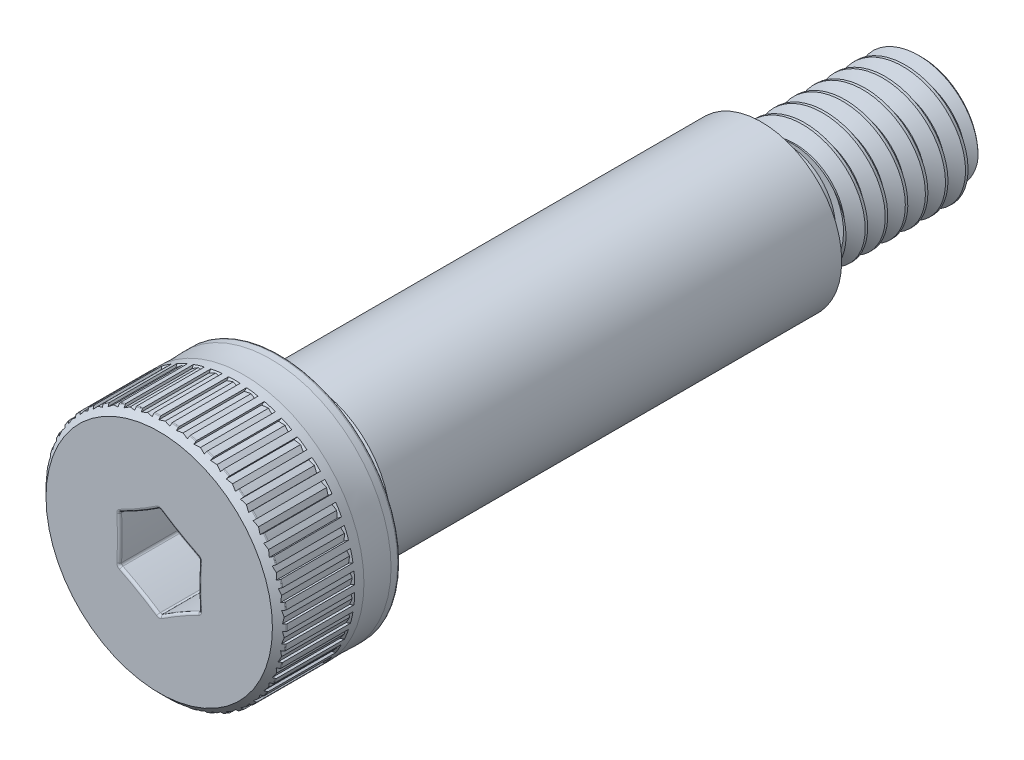
from build123d import *

# Parameters (mm, degrees)
SKETCH4_W             = 1.190625
SKETCH4_H             = 0.3175
SKETCH4_W_2           = 1.031875
SKETCH4_H_2           = 0.515555748
CHAMFER1_SIZE         = 0.3175
FILLET1_R             = 0.1905
FILLET2_R             = 0.15875
CHAMFER2_SIZE         = 0.1984375
CHAMFER3_SIZE         = 0.28575
CUT_EXTRUDE1_DEPTH    = 2.413
FILLET4_R             = 0.09525
DELETEFACE1_START     = -20.081875
DELETEFACE1_OUTLINE_W = 8
DELETEFACE1_OUTLINE_H = 8
DELETEFACE1_OUTLINE_R = 1.897444252
DELETEFACE1_DEPTH     = 0.1587501
CUT_SWEEP1_PITCH      = 0.79375
CUT_EXTRUDE2_REACH    = 32.905
CIRPATTERN1_COUNT     = 42
FILLET5_R             = 0.0508


# Read off the part's stored shape, not the designer's step: DeleteFace1, CirPattern2
with BuildPart() as part:
    # Sketch3 → Revolve1 (revolve)
    with BuildSketch(Plane(origin=(0, 0, 0), x_dir=(0, 0, -1), z_dir=(1, 0, 0)), mode=Mode.PRIVATE) as revolve1_sk:
        Polygon((-4.7625, 4.7625), (0, 4.7625), (0, 3.175), (19.05, 3.175), (19.05, 2.413), (25.4, 2.413), (25.4, 0), (-4.7625, 0), align=None)
    revolve(revolve1_sk.sketch.rotate(Axis((0, 0, 4.7625), (0, 0, -1)), 90), axis=Axis((0, 0, 4.7625), (0, 0, -1)))

    # Sketch4 → Cut-Revolve1 (revolve, cut)
    with BuildSketch(Plane(origin=(0, 0, 0), x_dir=(0, 0, -1), z_dir=(1, 0, 0)), mode=Mode.PRIVATE) as cut_revolve1_sk:
        with Locations((0.5953125, 3.01625)):
            Rectangle(SKETCH4_W, SKETCH4_H)
        with Locations((19.5659375, 2.155222126)):
            Rectangle(SKETCH4_W_2, SKETCH4_H_2)
    revolve(cut_revolve1_sk.sketch.rotate(Axis((0, 0, 4.7625), (0, 0, -1)), 90), axis=Axis((0, 0, 4.7625), (0, 0, -1)), mode=Mode.SUBTRACT)

    # Chamfer1
    chamfer1_edges = [part.edges().sort_by_distance(p)[0] for p in [
        (-2.8575, 0, -1.190625),
    ]]
    chamfer(chamfer1_edges, length=CHAMFER1_SIZE - 0.0001)  # a hair under: the kernel refuses the full size

    # Fillet1
    fillet1_edges = [part.edges().sort_by_distance(p)[0] for p in [
        (-2.8575, 0, 0),
    ]]
    fillet(fillet1_edges, radius=FILLET1_R)

    # Fillet2
    fillet2_edges = [part.edges().sort_by_distance(p)[0] for p in [
        (-1.897444252, 0, -19.05),
        (-1.897444252, 0, -20.081875),
    ]]
    fillet(fillet2_edges, radius=FILLET2_R)

    # Chamfer2
    chamfer2_edges = [part.edges().sort_by_distance(p)[0] for p in [
        (-2.413, 0, -20.081875),
        (-2.413, 0, -25.4),
    ]]
    chamfer(chamfer2_edges, length=CHAMFER2_SIZE)

    # Chamfer3
    chamfer3_edges = [part.edges().sort_by_distance(p)[0] for p in [
        (-4.7625, 0, 4.7625),
    ]]
    chamfer(chamfer3_edges, length=CHAMFER3_SIZE)

    # Sketch5 → Cut-Extrude1 (cut)
    with BuildSketch(Plane.XY.offset(4.7625)):
        with BuildLine():
            ThreePointArc((1.5875, 0.916543552), (0.777875, 1.347319022), (0, 1.833087105))
            ThreePointArc((0, 1.833087105), (-0.777875, 1.347319022), (-1.5875, 0.916543552))
            ThreePointArc((-1.5875, 0.916543552), (-1.55575, 0), (-1.5875, -0.916543552))
            ThreePointArc((-1.5875, -0.916543552), (-0.777875, -1.347319022), (0, -1.833087105))
            ThreePointArc((0, -1.833087105), (0.777875, -1.347319022), (1.5875, -0.916543552))
            ThreePointArc((1.5875, -0.916543552), (1.55575, 0), (1.5875, 0.916543552))
        make_face()
    extrude(amount=-CUT_EXTRUDE1_DEPTH, mode=Mode.SUBTRACT)

    # Fillet4
    fillet4_edges = [part.edges().sort_by_distance(p)[0] for p in [
        (1.55575, 0, 2.3495),
        (1.5875, 0.916543552, 3.556),
        (0.777875, -1.347319022, 2.3495),
        (1.5875, -0.916543552, 3.556),
        (-0.777875, -1.347319022, 2.3495),
        (0, -1.833087105, 3.556),
        (-1.55575, 0, 2.3495),
        (-1.5875, -0.916543552, 3.556),
        (-0.777875, 1.347319022, 2.3495),
        (-1.5875, 0.916543552, 3.556),
        (0.777875, 1.347319022, 2.3495),
        (0, 1.833087105, 3.556),
        (1.55575, 0, 4.7625),
        (0.777875, 1.347319022, 4.7625),
        (-0.777875, 1.347319022, 4.7625),
        (-1.55575, 0, 4.7625),
        (-0.777875, -1.347319022, 4.7625),
        (0.777875, -1.347319022, 4.7625),
        (-4.7625, 0, 0),
    ]]
    fillet(fillet4_edges, radius=FILLET4_R)

    # DeleteFace1 outline → DeleteFace1 (cut)
    with BuildSketch(Plane.XY.offset(DELETEFACE1_START)):
        Rectangle(DELETEFACE1_OUTLINE_W, DELETEFACE1_OUTLINE_H)
        Circle(DELETEFACE1_OUTLINE_R, mode=Mode.SUBTRACT)
    extrude(amount=DELETEFACE1_DEPTH, mode=Mode.SUBTRACT)

    # Cut-Sweep1: the profile of Sketch7 profile screwed along a right-hand helix of 7.48 turns, 8 arcs to a turn; built about Z, then put on its axis
    cut_sweep1_z = Axis((0, 0, 0), (0, 0, 1))
    cut_sweep1_corners = [(2.455962979, 0, 0.024804687), (2.455962979, 0, -0.719335937), (1.897144252, 0, -0.396701795), (1.897144252, 0, -0.297829455)]
    with BuildLine(mode=Mode.PRIVATE) as cut_sweep1_profile:
        Line(cut_sweep1_corners[0], cut_sweep1_corners[1])
        Line(cut_sweep1_corners[1], cut_sweep1_corners[2])
        Line(cut_sweep1_corners[2], cut_sweep1_corners[3])
        Line(cut_sweep1_corners[3], cut_sweep1_corners[0])
    cut_sweep1_cap = Face(cut_sweep1_profile.wire())
    cut_sweep1_turn_angles = [0, 22.5, 45, 67.5, 90, 112.5, 135, 157.5, 180, 202.5, 225, 247.5, 270, 292.5, 315, 337.5, 360]
    cut_sweep1_turn_weights = [1, 0.9238795325112867, 1, 0.9238795325112867, 1, 0.9238795325112867, 1, 0.9238795325112867, 1, 0.9238795325112867, 1, 0.9238795325112867, 1, 0.9238795325112867, 1, 0.9238795325112867, 1]
    cut_sweep1_turn_rails = [Edge.make_bspline([Vector(p[0], p[1], 0).rotate(cut_sweep1_z, cut_sweep1_turn_angles[k]) / cut_sweep1_turn_weights[k] + Vector(0, 0, p[2] + CUT_SWEEP1_PITCH * cut_sweep1_turn_angles[k] / 360) for k in range(17)], [0, 0, 0, 1, 1, 2, 2, 3, 3, 4, 4, 5, 5, 6, 6, 7, 7, 8, 8, 8], 2, cut_sweep1_turn_weights) for p in cut_sweep1_corners]
    cut_sweep1_turn_sides = [Face.make_surface_from_curves(cut_sweep1_turn_rails[p[0]], cut_sweep1_turn_rails[p[1]]) for p in [(0, 1), (1, 2), (2, 3), (3, 0)]]
    cut_sweep1_last_angles = [2520, 2542.5, 2565, 2587.5, 2610, 2632.5, 2655, 2673.9, 2692.8]
    cut_sweep1_last_weights = [1, 0.9238795325112867, 1, 0.9238795325112867, 1, 0.9238795325112867, 1, 0.9460853588275101, 1]
    cut_sweep1_last_rails = [Edge.make_bspline([Vector(p[0], p[1], 0).rotate(cut_sweep1_z, cut_sweep1_last_angles[k]) / cut_sweep1_last_weights[k] + Vector(0, 0, p[2] + CUT_SWEEP1_PITCH * cut_sweep1_last_angles[k] / 360) for k in range(9)], [0, 0, 0, 1, 1, 2, 2, 3, 3, 4, 4, 4], 2, cut_sweep1_last_weights) for p in cut_sweep1_corners]
    cut_sweep1_last_sides = [Face.make_surface_from_curves(cut_sweep1_last_rails[p[0]], cut_sweep1_last_rails[p[1]]) for p in [(0, 1), (1, 2), (2, 3), (3, 0)]]
    cut_sweep1 = Plane(origin=(0, 0, -25.4), x_dir=(0, 1, 0), z_dir=(0, 0, 1)) * Solid(Shell([*[p.moved(Location((0, 0, CUT_SWEEP1_PITCH * i))) for i in range(7) for p in cut_sweep1_turn_sides], *cut_sweep1_last_sides, cut_sweep1_cap, cut_sweep1_cap.rotate(cut_sweep1_z, 2692.8).moved(Location((0, 0, CUT_SWEEP1_PITCH * 2692.8 / 360)))]))
    add(cut_sweep1, mode=Mode.SUBTRACT)

    # Cut-Extrude2: up to this plane
    cut_extrude2_end = Plane(origin=(0, 5.814873764, 0.733563736), z_dir=(0, 0.707106781186546, 0.7071067811865491))
    # Sketch8 → Cut-Extrude2 (cut, up to the surface)
    with BuildSketch(Plane.XY.offset(4.7625), mode=Mode.PRIVATE) as cut_extrude2_sk1:
        Polygon((-0.2286, 4.7625), (0.2286, 4.7625), (0.218989269, 4.67106), (0, 4.71678), (-0.218989269, 4.67106), align=None)
    cut_extrude2_tool1 = split(extrude(cut_extrude2_sk1.sketch, amount=-CUT_EXTRUDE2_REACH, mode=Mode.PRIVATE), bisect_by=cut_extrude2_end, keep=Keep.BOTH, mode=Mode.PRIVATE)
    cut_extrude2 = cut_extrude2_tool1.solids().sort_by_distance((0, 4.727084, 4.7625))[0]
    add(cut_extrude2, mode=Mode.SUBTRACT)

    # CirPattern1: Cut-Extrude2 ×42 about axis
    cirpattern1_axis = Axis((0, 0, 0), (0, 0, 1))
    for i in range(1, CIRPATTERN1_COUNT):
        add(cut_extrude2.rotate(cirpattern1_axis, i * 360 / CIRPATTERN1_COUNT), mode=Mode.SUBTRACT)

    # Fillet5
    fillet5_edges = [part.edges().sort_by_distance(p)[0] for p in [
        (0.355902071, 4.749183084, 4.47675),
    ]]
    fillet(fillet5_edges, radius=FILLET5_R)

    # CirPattern2 outline → CirPattern2 (revolve, cut)
    with BuildSketch(Plane.XZ):
        with BuildLine():
            ThreePointArc((4.747621024, 4.491628976), (4.75863308, 4.47514827), (4.7625, 4.455707951))
            Line((4.7625, 4.455707951), (4.7625, 4.491628976))
            Line((4.7625, 4.491628976), (4.747621024, 4.491628976))
        make_face()
    revolve(axis=Axis((0, 0, 0), (0, 0, 1)), mode=Mode.SUBTRACT)

    # Sketch11 → Cut-Revolve6 (revolve, cut)
    with BuildSketch(Plane(origin=(0, 0, 0), x_dir=(0, 0, -1), z_dir=(1, 0, 0)), mode=Mode.PRIVATE) as cut_revolve6_sk:
        with BuildLine():
            Line((-1.42875, 4.7625), (-0.3571875, 4.7625))
            ThreePointArc((-0.3571875, 4.7625), (-0.89296875, 4.74472), (-1.42875, 4.7625))
        make_face()
    revolve(cut_revolve6_sk.sketch.rotate(Axis((0, 0, 4.7625), (0, 0, -1)), 90), axis=Axis((0, 0, 4.7625), (0, 0, -1)), mode=Mode.SUBTRACT)


solid = part.part
